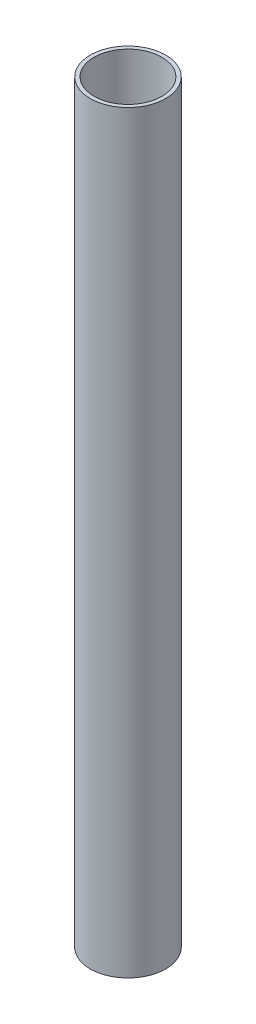
from build123d import *

# Parameters (mm, degrees)
SKETCH1_R           = 20
SKETCH1_R_2         = 18
BOSS_EXTRUDE1_DEPTH = 400


with BuildPart() as part:
    # Sketch1 → Boss-Extrude1 (new body)
    with BuildSketch(Plane(origin=(0, 0, 0), x_dir=(1, 0, 0), z_dir=(0, 1, 0))):
        Circle(SKETCH1_R)
        Circle(SKETCH1_R_2, mode=Mode.SUBTRACT)
    extrude(amount=BOSS_EXTRUDE1_DEPTH)


solid = part.part
